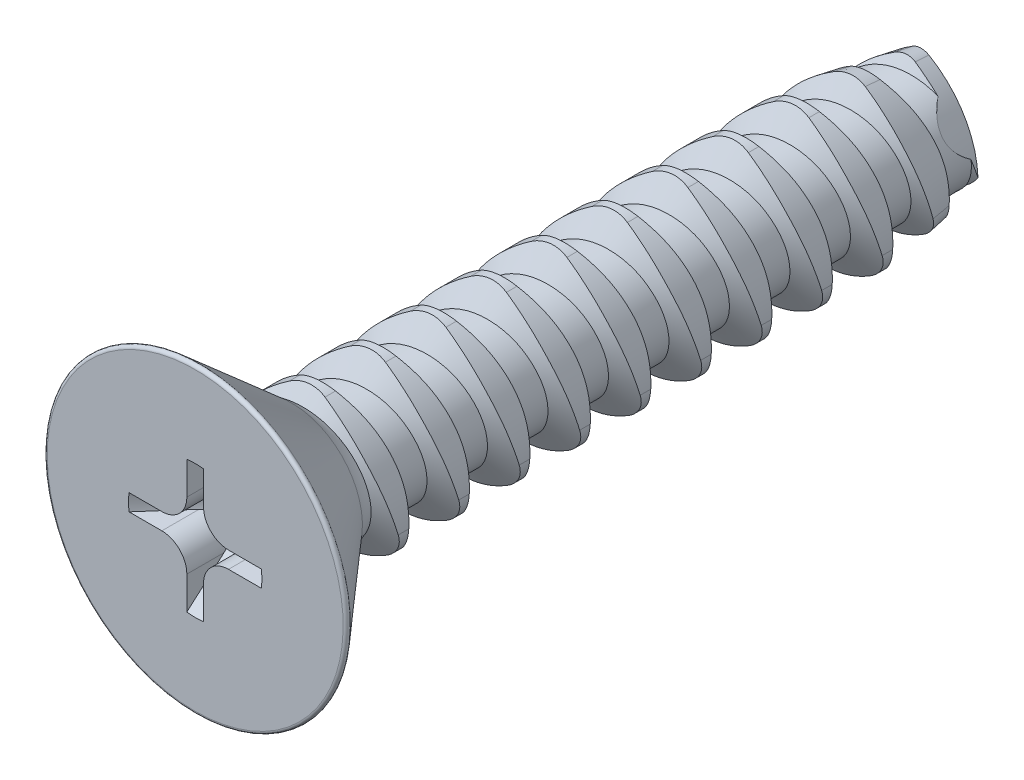
from build123d import *

# Parameters (mm, degrees)
CUT_EXTRUDE1_START   = -9.525
CUT_EXTRUDE1_2_DEPTH = 16.51
CUT_EXTRUDE1_3_DEPTH = 2.38125
CUT_EXTRUDE2_REACH   = 21.857
CIRPATTERN2_COUNT    = 4
CUT_SWEEP5_PITCH     = 1.5875
CUT_SWEEP5_TO        = 16.51


with BuildPart() as part:
    # Sketch3 → Revolve1 (revolve)
    with BuildSketch(Plane(origin=(0, 0, 0), x_dir=(0, 0, -1), z_dir=(1, 0, 0)), mode=Mode.PRIVATE) as revolve1_sk:
        with BuildLine():
            Line((-9.525, 0), (-9.525, 3.883152))
            ThreePointArc((-9.525, 3.883152), (-9.47861561, 3.955264611), (-9.393760634, 3.942961225))
            Line((-9.393760634, 3.942961225), (-6.985, 1.849057551))
            Line((-6.985, 1.849057551), (-6.985, 2.0828))
            Line((-6.985, 2.0828), (9.525, 2.0828))
            Line((9.525, 2.0828), (9.525, 0))
            Line((9.525, 0), (-9.525, 0))
        make_face()
    revolve(revolve1_sk.sketch.rotate(Axis((0, 0, 9.525), (0, 0, -1)), 180), axis=Axis((0, 0, 9.525), (0, 0, -1)))

    # Cut-Extrude1: read off the stored shape, not the designer's step
    # Cut-Extrude1 outline → Cut-Extrude1 (revolve, cut)
    with BuildSketch(Plane(origin=(-1.082254627, -0.62484, 0), x_dir=(1, 0, 0), z_dir=(0, -1, 0))):
        Polygon((2.997629253, -7.14375), (2.57775063, -9.525), (2.997629253, -9.525), align=None)
    revolve(axis=Axis((-1.082254627, -0.62484, 0), (0, 0, 1)), mode=Mode.SUBTRACT)

    # Cut-Extrude1 2 outline → Cut-Extrude1 2 (cut)
    with BuildSketch(Plane.XY.offset(CUT_EXTRUDE1_START)):
        with BuildLine():
            ThreePointArc((1.803757713, -1.041399997), (1.80375771, 1.041400001), (0, 2.0828))
            ThreePointArc((0, 2.0828), (0.215627323, 2.054412124), (0.41656, 1.971183084))
            ThreePointArc((0.41656, 1.971183084), (1.513768458, 0.873974627), (1.915374627, -0.62484))
            ThreePointArc((1.915374627, -0.62484), (1.886986752, -0.840467321), (1.803757713, -1.041399997))
        make_face()
        with BuildLine():
            ThreePointArc((-1.803757715, -1.041399994), (-2e-09, -2.0828), (1.803757713, -1.041399997))
            ThreePointArc((1.803757713, -1.041399997), (1.671359429, -1.2139448), (1.498814627, -1.346343084))
            ThreePointArc((1.498814627, -1.346343084), (0, -1.747949253), (-1.498814627, -1.346343084))
            ThreePointArc((-1.498814627, -1.346343084), (-1.671359431, -1.213944799), (-1.803757715, -1.041399994))
        make_face()
        with BuildLine():
            ThreePointArc((0, 2.0828), (-1.803757709, 1.041400003), (-1.803757715, -1.041399994))
            ThreePointArc((-1.803757715, -1.041399994), (-1.886986752, -0.840467319), (-1.915374627, -0.62484))
            ThreePointArc((-1.915374627, -0.62484), (-1.513768458, 0.873974627), (-0.41656, 1.971183084))
            ThreePointArc((-0.41656, 1.971183084), (-0.215627323, 2.054412124), (0, 2.0828))
        make_face()
    extrude(amount=CUT_EXTRUDE1_2_DEPTH, mode=Mode.SUBTRACT)

    # Cut-Extrude1 3 outline → Cut-Extrude1 3 (cut)
    with BuildSketch(Plane.XY.offset(CUT_EXTRUDE1_START)):
        with BuildLine():
            ThreePointArc((1.498814627, -1.346343084), (1.803757711, -1.0414), (1.915374627, -0.62484))
            ThreePointArc((1.915374627, -0.62484), (1.513768458, 0.873974627), (0.41656, 1.971183084))
            ThreePointArc((0.41656, 1.971183084), (0, 2.0828), (-0.41656, 1.971183084))
            ThreePointArc((-0.41656, 1.971183084), (-1.513768458, 0.873974627), (-1.915374627, -0.62484))
            ThreePointArc((-1.915374627, -0.62484), (-1.803757711, -1.0414), (-1.498814627, -1.346343084))
            ThreePointArc((-1.498814627, -1.346343084), (0, -1.747949253), (1.498814627, -1.346343084))
        make_face()
    extrude(amount=CUT_EXTRUDE1_3_DEPTH, mode=Mode.SUBTRACT)

    # Cut-Extrude1 4: loft between two sections, ruled curve by curve
    cut_extrude1_4_from = [
        Edge.make_three_point_arc((-1.288875315, -0.982717531, -9.525), (0, -1.32807063, -9.525), (1.288875315, -0.982717531, -9.525)),
        Edge.make_three_point_arc((-1.495496004, -0.62484, -9.525), (-1.440132157, -0.831460689, -9.525), (-1.288875315, -0.982717531, -9.525)),
        Edge.make_three_point_arc((-0.206620689, 1.607557531, -9.525), (-1.150142904, 0.664035315, -9.525), (-1.495496004, -0.62484, -9.525)),
        Edge.make_three_point_arc((0.206620689, 1.607557531, -9.525), (0, 1.662921377, -9.525), (-0.206620689, 1.607557531, -9.525)),
        Edge.make_three_point_arc((1.495496004, -0.62484, -9.525), (1.150142904, 0.664035315, -9.525), (0.206620689, 1.607557531, -9.525)),
        Edge.make_three_point_arc((1.288875315, -0.982717531, -9.525), (1.440132157, -0.831460689, -9.525), (1.495496004, -0.62484, -9.525)),
    ]
    cut_extrude1_4_to = [
        Edge.make_three_point_arc((-1.498814627, -1.346343084, -7.14375), (0, -1.747949253, -7.14375), (1.498814627, -1.346343084, -7.14375)),
        Edge.make_three_point_arc((-1.915374627, -0.62484, -7.14375), (-1.803757711, -1.0414, -7.14375), (-1.498814627, -1.346343084, -7.14375)),
        Edge.make_three_point_arc((-0.41656, 1.971183084, -7.14375), (-1.513768458, 0.873974627, -7.14375), (-1.915374627, -0.62484, -7.14375)),
        Edge.make_three_point_arc((0.41656, 1.971183084, -7.14375), (0, 2.0828, -7.14375), (-0.41656, 1.971183084, -7.14375)),
        Edge.make_three_point_arc((1.915374627, -0.62484, -7.14375), (1.513768458, 0.873974627, -7.14375), (0.41656, 1.971183084, -7.14375)),
        Edge.make_three_point_arc((1.498814627, -1.346343084, -7.14375), (1.803757711, -1.0414, -7.14375), (1.915374627, -0.62484, -7.14375)),
    ]
    cut_extrude1_4 = Solid(Shell([*[Face.make_surface_from_curves(cut_extrude1_4_from[k], cut_extrude1_4_to[k]) for k in range(6)], Face(Wire(cut_extrude1_4_from)), Face(Wire(cut_extrude1_4_to))]))
    add(cut_extrude1_4)

    # Cut-Extrude2: up to this cone (the profile starts inside it)
    cut_extrude2_end = Plane(origin=(0, 0, 9.525), z_dir=(0, 0, 1)).offset(-2.013143713) * Cone(1e-06, 22.705895389, 26.120143713, align=(Align.CENTER, Align.CENTER, Align.MIN), mode=Mode.PRIVATE)
    # Cut-Extrude2 Sketch → Cut-Extrude2 (cut, up to the surface)
    with BuildSketch(Plane.XY.offset(9.525), mode=Mode.PRIVATE) as cut_extrude2_sk1:
        with BuildLine():
            Line((0, 1.75), (0, 0))
            Line((0, 0), (1.75, 0))
            ThreePointArc((1.75, 0), (1.746565204, 0.109590097), (1.736274298, 0.21875))
            Line((1.736274298, 0.21875), (0.875, 0.21875))
            ThreePointArc((0.875, 0.21875), (0.410961175, 0.410961175), (0.21875, 0.875))
            Line((0.21875, 0.875), (0.21875, 1.736274298))
            ThreePointArc((0.21875, 1.736274298), (0.109590097, 1.746565204), (0, 1.75))
        make_face()
    cut_extrude2_tool1 = extrude(cut_extrude2_sk1.sketch, amount=-CUT_EXTRUDE2_REACH, mode=Mode.PRIVATE) & cut_extrude2_end
    cut_extrude2 = cut_extrude2_tool1.solids().sort_by_distance((0.024749, 0.875, 9.525))[0]
    add(cut_extrude2, mode=Mode.SUBTRACT)

    # CirPattern2: Cut-Extrude2 ×4 about axis
    cirpattern2_axis = Axis((0, 0, 0), (0, 0, 1))
    for i in range(1, CIRPATTERN2_COUNT):
        add(cut_extrude2.rotate(cirpattern2_axis, i * 360 / CIRPATTERN2_COUNT), mode=Mode.SUBTRACT)


with BuildPart() as body_2:
    # Split1: read off the stored shape, not the designer's step
    # Split1: the piece on the far side of the plane
    add(part.part)
    split(bisect_by=Plane.XY.offset(6.985), keep=Keep.BOTTOM)

    # Cut-Sweep5: arcs per turn and ends read off the stored shape
    # Cut-Sweep5: the profile of Sketch8 screwed along a right-hand helix through 13 turns, 8 arcs to a turn; built about Z, then put on its axis
    cut_sweep5_z = Axis((0, 0, 0), (0, 0, 1))
    cut_sweep5_corners = [(2.168725958, 0, 0.049609375), (2.168725958, 0, -1.438671875), (1.460901916, 0, -1.030009474), (1.460901916, 0, -0.359053026)]
    with BuildLine(mode=Mode.PRIVATE) as cut_sweep5_profile:
        Line(cut_sweep5_corners[0], cut_sweep5_corners[1])
        Line(cut_sweep5_corners[1], cut_sweep5_corners[2])
        Line(cut_sweep5_corners[2], cut_sweep5_corners[3])
        Line(cut_sweep5_corners[3], cut_sweep5_corners[0])
    cut_sweep5_cap = Face(cut_sweep5_profile.wire())
    cut_sweep5_turn_angles = [0, 22.5, 45, 67.5, 90, 112.5, 135, 157.5, 180, 202.5, 225, 247.5, 270, 292.5, 315, 337.5, 360]
    cut_sweep5_turn_weights = [1, 0.9238795325112867, 1, 0.9238795325112867, 1, 0.9238795325112867, 1, 0.9238795325112867, 1, 0.9238795325112867, 1, 0.9238795325112867, 1, 0.9238795325112867, 1, 0.9238795325112867, 1]
    cut_sweep5_turn_rails = [Edge.make_bspline([Vector(p[0], p[1], 0).rotate(cut_sweep5_z, cut_sweep5_turn_angles[k]) / cut_sweep5_turn_weights[k] + Vector(0, 0, p[2] + CUT_SWEEP5_PITCH * cut_sweep5_turn_angles[k] / 360) for k in range(17)], [0, 0, 0, 1, 1, 2, 2, 3, 3, 4, 4, 5, 5, 6, 6, 7, 7, 8, 8, 8], 2, cut_sweep5_turn_weights) for p in cut_sweep5_corners]
    cut_sweep5_turn_sides = [Face.make_surface_from_curves(cut_sweep5_turn_rails[p[0]], cut_sweep5_turn_rails[p[1]]) for p in [(0, 1), (1, 2), (2, 3), (3, 0)]]
    cut_sweep5 = Plane(origin=(0, 0, -9.525), x_dir=(0, 1, 0), z_dir=(0, 0, 1)) * split(Solid(Shell([*[p.moved(Location((0, 0, CUT_SWEEP5_PITCH * i))) for i in range(13) for p in cut_sweep5_turn_sides], cut_sweep5_cap, cut_sweep5_cap.rotate(cut_sweep5_z, 4680).moved(Location((0, 0, CUT_SWEEP5_PITCH * 4680 / 360)))])), bisect_by=Plane.XY.offset(CUT_SWEEP5_TO), keep=Keep.BOTTOM, mode=Mode.PRIVATE)
    add(cut_sweep5, mode=Mode.SUBTRACT)


with BuildPart() as part_1:
    add(part.part)

    # Split1
    split(bisect_by=Plane.XY.offset(6.985), keep=Keep.TOP)

    add(body_2.part)  # Revolve2 merges body 2
    # Sketch9 → Revolve2 (revolve)
    with BuildSketch(Plane(origin=(0, 0, 0), x_dir=(0, 0, -1), z_dir=(1, 0, 0)), mode=Mode.PRIVATE) as revolve2_sk:
        with BuildLine():
            Line((-6.985, 1.849057551), (-6.985, 0))
            Line((-6.985, 0), (-5.946830596, 0))
            Line((-5.946830596, 0), (-5.946830596, 1.460901916))
            ThreePointArc((-5.946830596, 1.460901916), (-6.501010284, 1.561113928), (-6.985, 1.849057551))
        make_face()
    revolve(revolve2_sk.sketch.rotate(Axis((0, 0, 6.985), (0, 0, -1)), 180), axis=Axis((0, 0, 6.985), (0, 0, -1)))


solid = part_1.part
